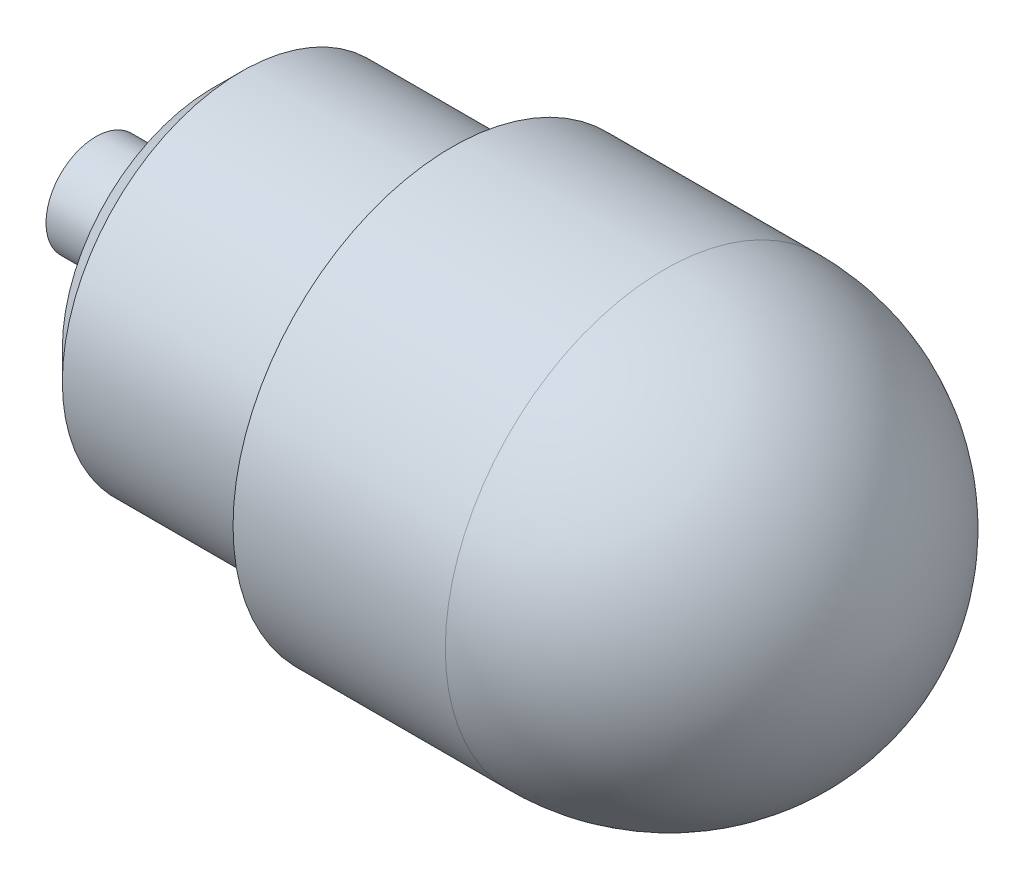
from build123d import *


with BuildPart() as part:
    # Sketch1 → Revolve1 (revolve)
    with BuildSketch(Plane.XY):
        with BuildLine():
            Line((14.835685253, 0), (14.835685253, 6.327073891))
            Line((14.835685253, 6.327073891), (29.657803747, 6.327073891))
            Line((29.657803747, 6.327073891), (29.657803747, 19.077283347))
            Line((29.657803747, 19.077283347), (33.323488965, 22.742968566))
            Line((33.323488965, 22.742968566), (60.002583426, 22.742968566))
            Line((60.002583426, 22.742968566), (60.002583426, 27.76336354))
            Line((60.002583426, 27.76336354), (86.937400903, 27.76336354))
            ThreePointArc((86.937400903, 27.76336354), (107.04830062, 19.709310079), (116.040472815, 0))
            Line((116.040472815, 0), (14.835685253, 0))
        make_face()
    revolve(axis=Axis((0, 0, 0), (1, 0, 0)))


solid = part.part
